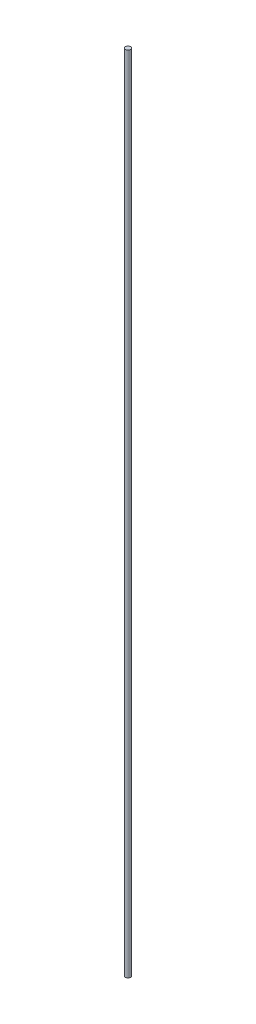
from build123d import *

# Parameters (mm, degrees)
SWEEP1_PROFILE_R = 6.35


with BuildPart() as part:
    # Sweep1: sweep along a path in Sketch1
    with BuildLine(Plane.XY) as sweep1_path:
        Line((0, 0), (0, 2003.806))
    # Sweep1 profile (on start of the path) → Sweep1 (sweep)
    with BuildSketch(Plane.ZX):
        Circle(SWEEP1_PROFILE_R)
    sweep(path=sweep1_path.line)


solid = part.part
